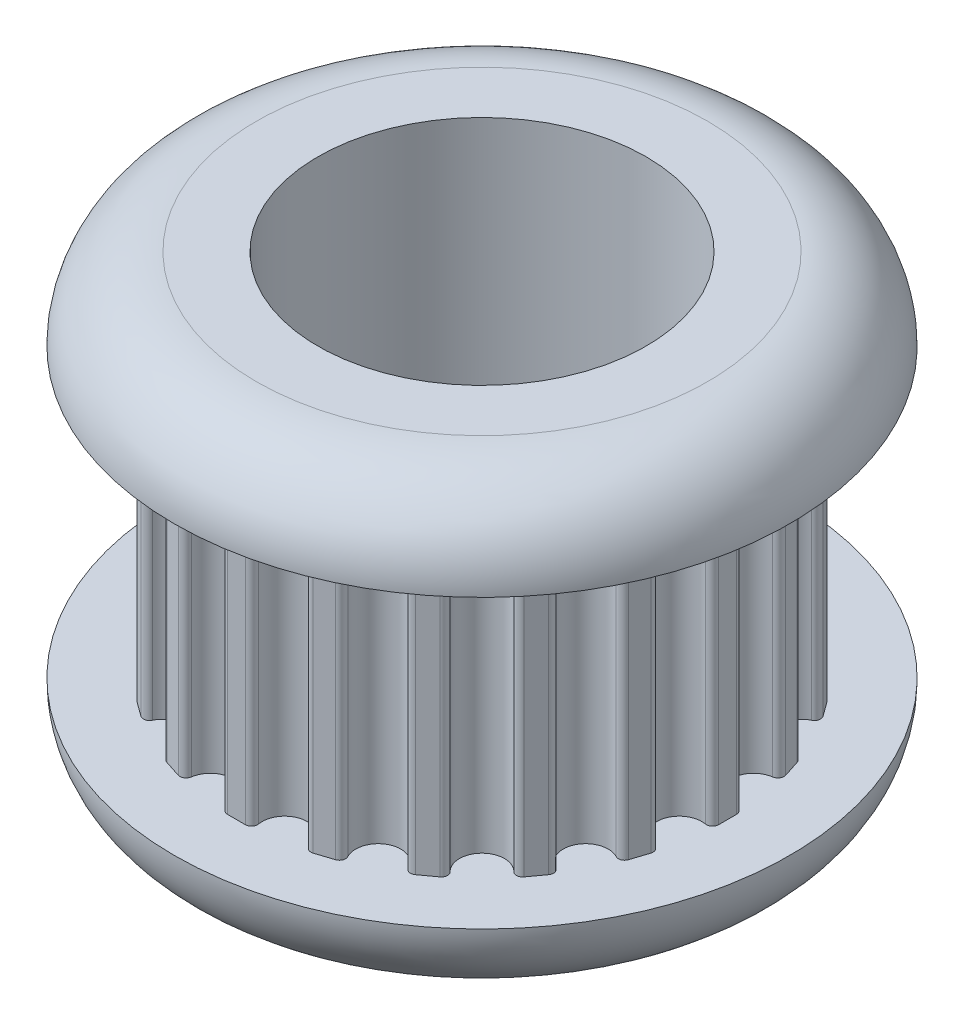
from build123d import *

# Parameters (mm, degrees)
SKETCH1_R           = 6.365
BOSS_EXTRUDE2_DEPTH = 7
CUT_EXTRUDE1_DEPTH  = 7
CIRPATTERN1_COUNT   = 20
SKETCH3_R           = 7.5
BOSS_EXTRUDE3_DEPTH = 2
FILLET1_R           = 2
BOSS_EXTRUDE4_START = 2
SKETCH4_R           = 7.5
BOSS_EXTRUDE4_DEPTH = 2
FILLET2_R           = 2
SKETCH5_R           = 4
CUT_EXTRUDE2_DEPTH  = 16.280706888


with BuildPart() as part:
    # Sketch1 → Boss-Extrude2 (new body)
    with BuildSketch(Plane(origin=(0, 0, 0), x_dir=(1, 0, 0), z_dir=(0, 1, 0))):
        with Locations(Location((0, 0, 0), (0, 0, 270))):
            Circle(SKETCH1_R)
    extrude(amount=BOSS_EXTRUDE2_DEPTH)

    # Sketch2 → Cut-Extrude1 (cut)
    with BuildSketch(Plane(origin=(0, 7, 0), x_dir=(1, 0, 0), z_dir=(0, 1, 0))):
        with BuildLine():
            Line((0, 5.985), (0.21554971, 5.985))
            ThreePointArc((0.21554971, 5.985), (0.330433243, 5.931445705), (0.363283354, 5.809023654))
            ThreePointArc((0.363283354, 5.809023654), (0.818934424, 5.170548463), (1.449584029, 5.636970529))
            ThreePointArc((1.449584029, 5.636970529), (1.518656835, 5.743249576), (1.644466755, 5.758681774))
            Line((1.644466755, 5.758681774), (1.849466711, 5.69207325))
            Line((1.849466711, 5.69207325), (1.966893169, 6.053474726))
            Line((1.966893169, 6.053474726), (1.188040248, 6.306539381))
            Line((1.188040248, 6.306539381), (0.818934424, 6.365))
            Line((0.818934424, 6.365), (0, 6.365))
            Line((0, 6.365), (0, 5.985))
        make_face()
    cut_extrude1 = extrude(amount=-CUT_EXTRUDE1_DEPTH, mode=Mode.SUBTRACT)

    # CirPattern1: Cut-Extrude1 ×20 about axis
    cirpattern1_axis = Axis((0, 0, 0), (0, 1, 0))
    for i in range(1, CIRPATTERN1_COUNT):
        add(cut_extrude1.rotate(cirpattern1_axis, i * 360 / CIRPATTERN1_COUNT), mode=Mode.SUBTRACT)

    # Sketch3 → Boss-Extrude3 (add)
    with BuildSketch(Plane(origin=(0, 7, 0), x_dir=(1, 0, 0), z_dir=(0, 1, 0))):
        with Locations(Location((0, 0, 0), (0, 0, 270))):
            Circle(SKETCH3_R)
    extrude(amount=BOSS_EXTRUDE3_DEPTH)

    # Fillet1
    fillet1_edges = [part.edges().sort_by_distance(p)[0] for p in [
        (0, 9, -7.5),
    ]]
    fillet(fillet1_edges, radius=FILLET1_R - 0.0001)  # a hair under: the kernel refuses the full size

    # Sketch4 → Boss-Extrude4 (add)
    with BuildSketch(Plane.XZ.offset(BOSS_EXTRUDE4_START)):
        with Locations(Location((0, 0, 0), (0, 0, 270))):
            Circle(SKETCH4_R)
    extrude(amount=-BOSS_EXTRUDE4_DEPTH)

    # Fillet2
    fillet2_edges = [part.edges().sort_by_distance(p)[0] for p in [
        (0, -2, 7.5),
    ]]
    fillet(fillet2_edges, radius=FILLET2_R - 0.0001)  # a hair under: the kernel refuses the full size

    # Sketch5 → Cut-Extrude2 (cut, through all)
    with BuildSketch(Plane.XZ.offset(2)):
        with Locations(Location((0, 0, 0), (0, 0, 270))):
            Circle(SKETCH5_R)
    extrude(amount=-CUT_EXTRUDE2_DEPTH, mode=Mode.SUBTRACT)


solid = part.part
